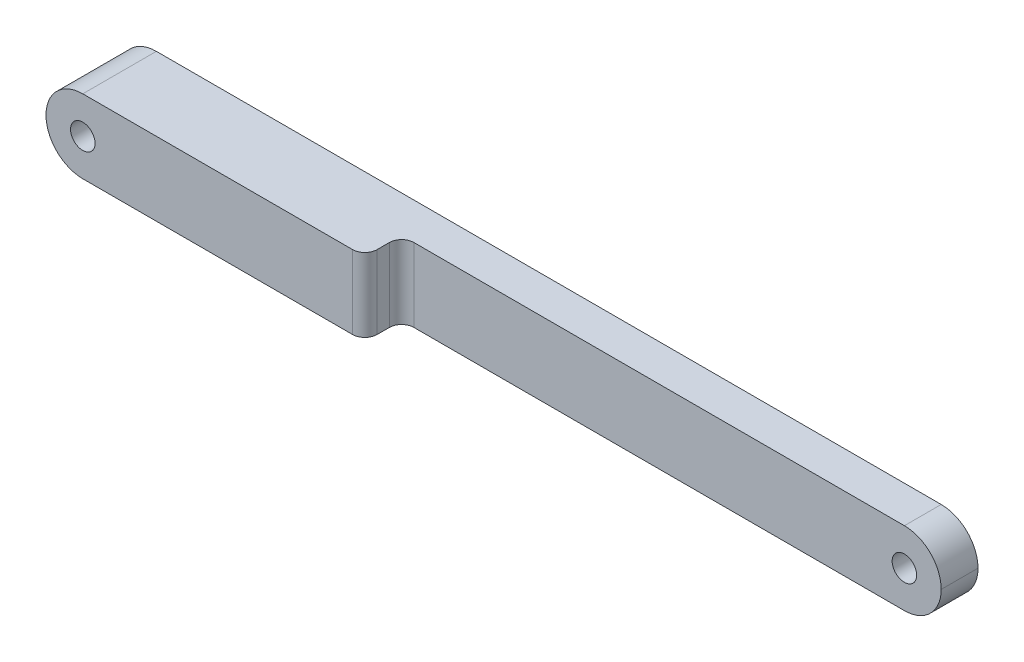
from build123d import *

# Parameters (mm, degrees)
SKETCH1_W               = 350
SKETCH1_H               = 30
BOSS_EXTRUDE1_DEPTH     = 15
CUT_EXTRUDE2_DEPTH      = 353.562051276
CUT_EXTRUDE2_DEPTH_BACK = 353.562051276
SKETCH3_R               = 5
FILLET3_R               = 15
CUT_EXTRUDE3_DEPTH      = 353.562051276
CUT_EXTRUDE3_DEPTH_BACK = 10
SKETCH4_R               = 5
FILLET4_R               = 5
CUT_EXTRUDE4_REACH      = 353.603
SKETCH6_W               = 245
SKETCH6_H               = 5
FILLET6_R               = 5


with BuildPart() as part:
    # Sketch1 → Boss-Extrude1 (new, symmetric)
    with BuildSketch(Plane.XY):
        with Locations((175, 15)):
            Rectangle(SKETCH1_W, SKETCH1_H)
    extrude(amount=BOSS_EXTRUDE1_DEPTH, both=True)

    # Sketch3 → Cut-Extrude2 (cut, two sides: drawn at the far end of the back side and taken through both)
    with BuildSketch(Plane.XY.offset(15).offset(-CUT_EXTRUDE2_DEPTH_BACK)):
        with Locations((15, 15)):
            Circle(SKETCH3_R)
        with Locations((335, 15)):
            Circle(SKETCH3_R)
    extrude(amount=CUT_EXTRUDE2_DEPTH + CUT_EXTRUDE2_DEPTH_BACK, mode=Mode.SUBTRACT)

    # Fillet3
    fillet3_edges = [part.edges().sort_by_distance(p)[0] for p in [
        (350, 0, 0),
        (350, 30, 0),
        (0, 0, 0),
        (0, 30, 0),
    ]]
    fillet(fillet3_edges, radius=FILLET3_R - 0.0001)  # a hair under: the kernel refuses the full size

    # Sketch4 → Cut-Extrude3 (cut, two sides: drawn at the far end of the back side and taken through both)
    with BuildSketch(Plane.XY.offset(15).offset(-CUT_EXTRUDE3_DEPTH_BACK)):
        with BuildLine():
            Line((130, 30), (130, 0))
            Line((130, 0), (335.0001, 0))
            ThreePointArc((335.0001, 0), (345.606631007, 4.393368993), (350, 14.9999))
            Line((350, 14.9999), (350, 15.0001))
            ThreePointArc((350, 15.0001), (345.606631007, 25.606631007), (335.0001, 30))
            Line((335.0001, 30), (130, 30))
        make_face()
        with Locations((335, 15)):
            Circle(SKETCH4_R, mode=Mode.SUBTRACT)
    extrude(amount=CUT_EXTRUDE3_DEPTH + CUT_EXTRUDE3_DEPTH_BACK, mode=Mode.SUBTRACT)

    # Fillet4
    fillet4_edges = [part.edges().sort_by_distance(p)[0] for p in [
        (130, 15, 15),
    ]]
    fillet(fillet4_edges, radius=FILLET4_R)

    # Sketch6 → Cut-Extrude4 (cut, up to next)
    with BuildSketch(Plane.XZ, mode=Mode.PRIVATE) as cut_extrude4_sk1:
        with Locations((252.5, 2.5)):
            Rectangle(SKETCH6_W, SKETCH6_H)
    cut_extrude4_tool1 = extrude(cut_extrude4_sk1.sketch, amount=-CUT_EXTRUDE4_REACH, mode=Mode.PRIVATE) & part.part
    add(cut_extrude4_tool1.solids().sort_by_distance((252.5, 0, 2.5))[0], mode=Mode.SUBTRACT)

    # Fillet6
    fillet6_edges = [part.edges().sort_by_distance(p)[0] for p in [
        (130, 15, 0),
    ]]
    fillet(fillet6_edges, radius=FILLET6_R)


solid = part.part
